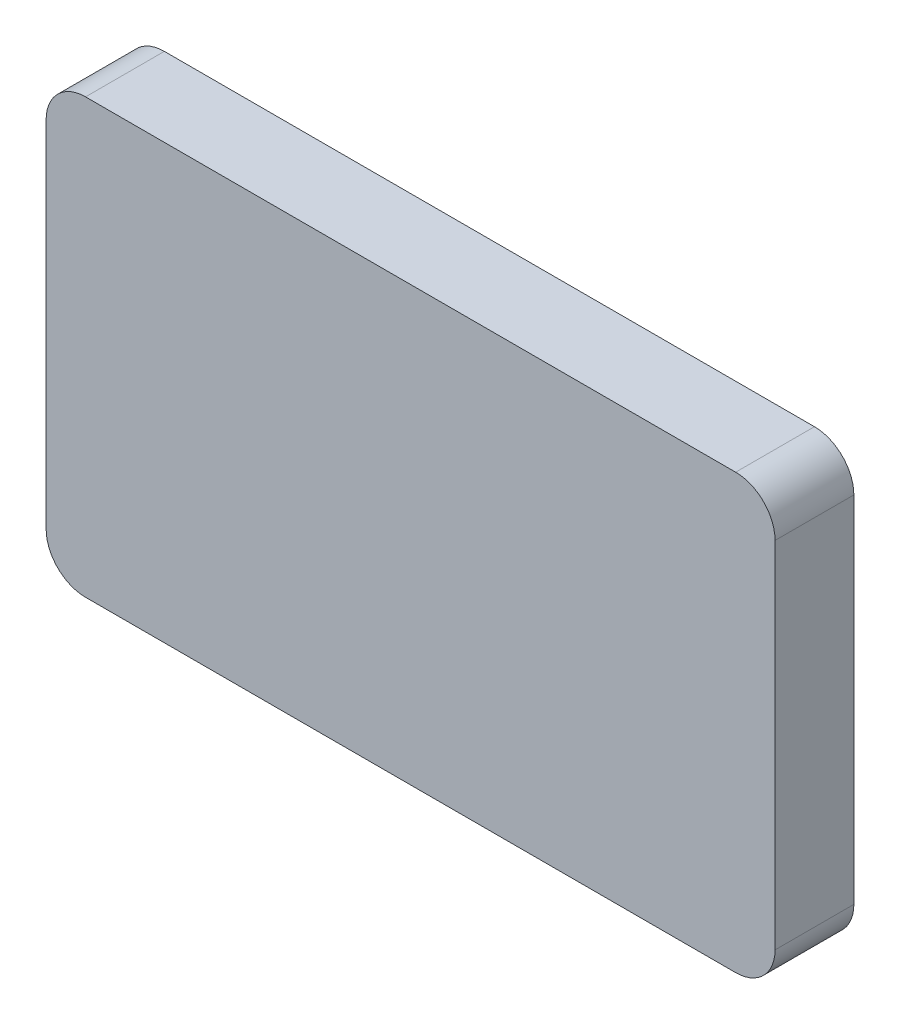
from build123d import *

# Parameters (mm, degrees)
BOSS_EXTRUDE2_DEPTH = 2
FILLET1_R           = 1


with BuildPart() as part:
    # Sketch1 → Boss-Extrude2 (new body)
    with BuildSketch(Plane.XY):
        Polygon((0, 11), (0, 0), (18.5, 0), (18.5, 4.9872583), (18.5, 7.25), (18.5, 11), align=None)
    extrude(amount=BOSS_EXTRUDE2_DEPTH)

    # Fillet1
    fillet1_edges = [part.edges().sort_by_distance(p)[0] for p in [
        (0, 0, 1),
        (18.5, 0, 1),
        (18.5, 11, 1),
        (0, 11, 1),
    ]]
    fillet(fillet1_edges, radius=FILLET1_R)


solid = part.part
